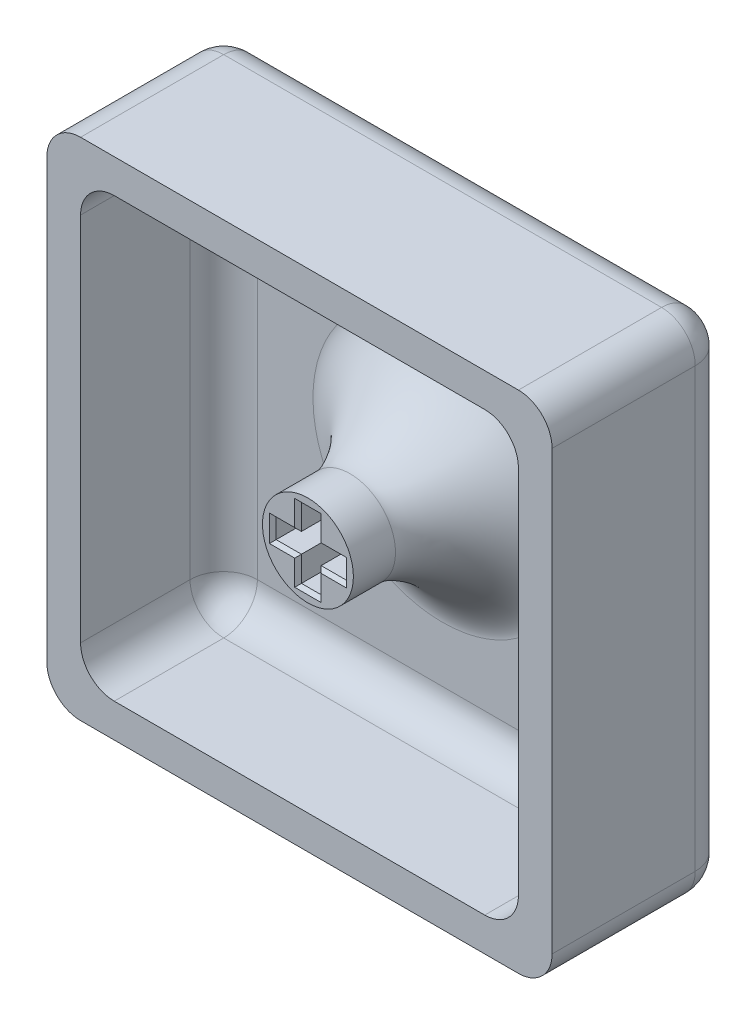
from build123d import *

# Parameters (mm, degrees)
EXTRUDE_1_DEPTH = 8.5
SKETCH_1_6_R    = 2.7
EXTRUDE_2_DEPTH = 8
EXTRUDE_START   = -2
EXTRUDE_3_DEPTH = 2
FILLET_1_R      = 2
CHAMFER_1_SIZE  = 0.2
FILLET_2_R      = 2
FILLET_3_SIZE   = 5
FILLET_3_SIZE_2 = 5.5


with BuildPart() as part:
    # 草图1 → 凸台-拉伸1 (new body)
    with BuildSketch(Plane.XY):
        with BuildLine():
            ThreePointArc((-15, 13), (-14.414213562, 14.414213562), (-13, 15))
            Line((-13, 15), (13, 15))
            ThreePointArc((13, 15), (14.414213562, 14.414213562), (15, 13))
            Line((15, 13), (15, -13))
            ThreePointArc((15, -13), (14.414213562, -14.414213562), (13, -15))
            Line((13, -15), (-13, -15))
            ThreePointArc((-13, -15), (-14.414213562, -14.414213562), (-15, -13))
            Line((-15, -13), (-15, 13))
        make_face()
        with BuildLine():
            ThreePointArc((-13, -11), (-12.414213562, -12.414213562), (-11, -13))
            Line((-11, -13), (11, -13))
            ThreePointArc((11, -13), (12.414213562, -12.414213562), (13, -11))
            Line((13, -11), (13, 11))
            ThreePointArc((13, 11), (12.414213562, 12.414213562), (11, 13))
            Line((11, 13), (-11, 13))
            ThreePointArc((-11, 13), (-12.414213562, 12.414213562), (-13, 11))
            Line((-13, 11), (-13, -11))
        make_face(mode=Mode.SUBTRACT)
    extrude(amount=EXTRUDE_1_DEPTH)



with BuildPart() as body_2:
    # 草图1<6> → 凸台-拉伸2 (new body)
    with BuildSketch(Plane.XY):
        Circle(SKETCH_1_6_R)
        Polygon((-2.085, -0.585), (-2.085, 0.585), (-0.585, 0.585), (-0.585, 2.085), (0.585, 2.085), (0.585, 0.585), (2.085, 0.585), (2.085, -0.585), (0.585, -0.585), (0.585, -2.085), (-0.585, -2.085), (-0.585, -0.585), align=None, mode=Mode.SUBTRACT)
    extrude(amount=EXTRUDE_2_DEPTH)


with BuildPart() as part_1:
    add(part.part)

    add(body_2.part)  # 凸台-拉伸3 merges body 2
    # 草图1<7> → 凸台-拉伸3 (add)
    with BuildSketch(Plane.XY.offset(EXTRUDE_START)):
        with BuildLine():
            Line((-13, 15), (13, 15))
            ThreePointArc((13, 15), (14.414213562, 14.414213562), (15, 13))
            Line((15, 13), (15, -13))
            ThreePointArc((15, -13), (14.414213562, -14.414213562), (13, -15))
            Line((13, -15), (-13, -15))
            ThreePointArc((-13, -15), (-14.414213562, -14.414213562), (-15, -13))
            Line((-15, -13), (-15, 13))
            ThreePointArc((-15, 13), (-14.414213562, 14.414213562), (-13, 15))
        make_face()
    extrude(amount=EXTRUDE_3_DEPTH)

    # 圆角1
    fillet_1_edges = [part_1.edges().sort_by_distance(p)[0] for p in [
        (-14.414213562, -14.414213562, -2),
        (-15, 0, -2),
        (14.414213562, 14.414213562, -2),
        (14.414213562, -14.414213562, -2),
        (0, -15, -2),
        (-14.414213562, 14.414213562, -2),
        (0, 15, -2),
        (15, 0, -2),
    ]]
    fillet(fillet_1_edges, radius=FILLET_1_R)

    # 倒角1
    chamfer_1_edges = [part_1.edges().sort_by_distance(p)[0] for p in [
        (1.335, -0.585, 8),
        (0, -2.085, 8),
        (-0.585, -1.335, 8),
        (-1.335, -0.585, 8),
        (-2.085, 0, 8),
        (-0.585, 1.335, 8),
        (0, 2.085, 8),
        (0.585, 1.335, 8),
        (1.335, 0.585, 8),
        (2.085, 0, 8),
        (0.585, -1.335, 8),
        (-1.335, 0.585, 8),
    ]]
    chamfer(chamfer_1_edges, length=CHAMFER_1_SIZE)

    # 圆角2
    fillet_2_edges = [part_1.edges().sort_by_distance(p)[0] for p in [
        (0, -13, 0),
        (12.414213562, -12.414213562, 0),
        (13, 0, 0),
        (12.414213562, 12.414213562, 0),
        (0, 13, 0),
        (-12.414213562, 12.414213562, 0),
        (-13, 0, 0),
        (-12.414213562, -12.414213562, 0),
    ]]
    fillet(fillet_2_edges, radius=FILLET_2_R)

    # 圆角3
    # a fillet whose section is not a circle: 5.5, 5 mm, written as the material it adds along each edge
    with BuildSketch(Plane(origin=(0, 0, 0), x_dir=(1, 0, 0), z_dir=(0, -1, 0))) as fillet_3_piece_1:
        with BuildLine():
            Bezier((2.7 + FILLET_3_SIZE, 0), (2.7, 0), (2.7, FILLET_3_SIZE_2), weights=[1, 0.333333333, 1])
            Line((2.7, FILLET_3_SIZE_2), (2.7, 0))
            Line((2.7, 0), (2.7 + FILLET_3_SIZE, 0))
        make_face()
    revolve(axis=Axis((0, 0, 0), (0, 0, 1)))


solid = part_1.part
